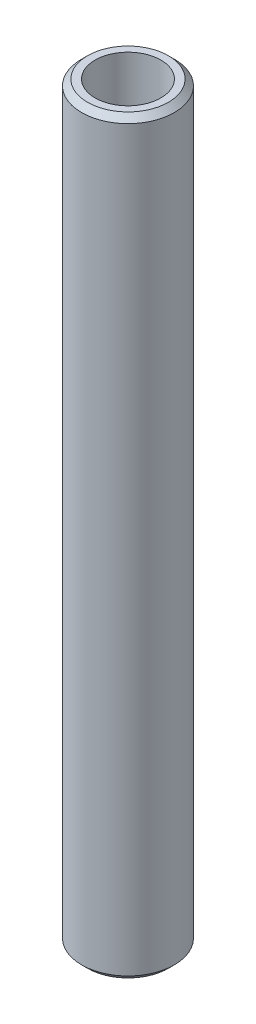
from build123d import *

# Parameters (mm, degrees)
SKETCH1_R           = 20
BOSS_EXTRUDE1_DEPTH = 323.712810344
SKETCH2_R           = 14.191150513
CUT_EXTRUDE1_DEPTH  = 325.94612412
CHAMFER1_SIZE       = 2.564065659


with BuildPart() as part:
    # Sketch1 → Boss-Extrude1 (new body)
    with BuildSketch(Plane(origin=(0, 0, 0), x_dir=(1, 0, 0), z_dir=(0, 1, 0))):
        Circle(SKETCH1_R)
    extrude(amount=BOSS_EXTRUDE1_DEPTH)

    # Sketch2 → Cut-Extrude1 (cut, through all)
    with BuildSketch(Plane(origin=(0, 0, 0), x_dir=(1, 0, 0), z_dir=(0, 1, 0))):
        Circle(SKETCH2_R)
    extrude(amount=CUT_EXTRUDE1_DEPTH, mode=Mode.SUBTRACT)

    # Chamfer1
    chamfer1_edges = [part.edges().sort_by_distance(p)[0] for p in [
        (-20, 323.712810344, 0),
        (-20, 0, 0),
    ]]
    chamfer(chamfer1_edges, length=CHAMFER1_SIZE)


solid = part.part
